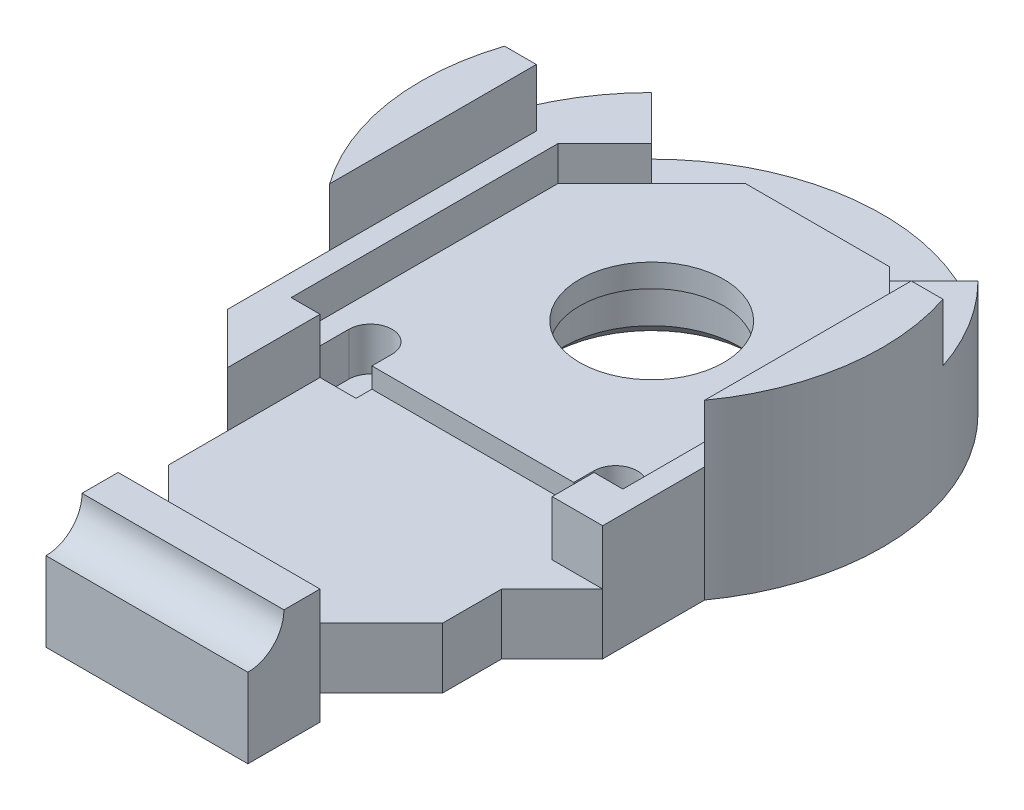
from build123d import *
from build123d.topology import SkipClean

# Parameters (mm, degrees)
BOSS_EXTRUDE1_DEPTH      = 4
SKETCH2_R                = 3.05
CUT_EXTRUDE1_DEPTH       = 2
SKETCH3_R                = 1.5
CUT_EXTRUDE2_DEPTH       = 22.633307653
CUT_EXTRUDE4_START       = -1.2
CUT_EXTRUDE4_DEPTH       = 1.2
CUT_EXTRUDE6_DEPTH       = 1.5
CUT_EXTRUDE7_DEPTH       = 0.7
BOSS_EXTRUDE3_DEPTH      = 2
CUT_EXTRUDE12_START      = -2
CUT_EXTRUDE12_DEPTH      = 2
SKETCH6_R                = 2.5
CUT_EXTRUDE13_DEPTH      = 22.777052142
SKETCH17_W               = 0.35
SKETCH17_H               = 1.45
CUT_EXTRUDE14_DEPTH      = 1.9
BOSS_EXTRUDE5_DEPTH      = 1.9
CUT_EXTRUDE15_DEPTH      = 22.9089023
CUT_EXTRUDE15_DEPTH_BACK = 22.9089023
CUT_EXTRUDE16_DEPTH      = 22.890865675
CUT_EXTRUDE16_DEPTH_BACK = 22.890865675
CUT_EXTRUDE17_DEPTH      = 24.837994882
CUT_EXTRUDE17_DEPTH_BACK = 24.837994882
CHAMFER1_SIZE            = 1.75
CUT_EXTRUDE18_DEPTH      = 24.837994882
BOSS_EXTRUDE6_DEPTH      = 1.9
CHAMFER2_SIZE            = 0.5


with BuildPart() as part:
    # Sketch1 → Boss-Extrude1 (new body)
    with BuildSketch(Plane(origin=(0, 0, 0), x_dir=(1, 0, 0), z_dir=(0, 1, 0))):
        with BuildLine():
            Line((6.5, -20), (6.5, -4.663689527))
            ThreePointArc((6.5, -4.663689527), (7.615773106, -2.449489743), (8, 0))
            ThreePointArc((8, 0), (7.615773106, 2.449489743), (6.5, 4.663689527))
            ThreePointArc((6.5, 4.663689527), (0, 8), (-6.5, 4.663689527))
            ThreePointArc((-6.5, 4.663689527), (-7.615773106, 2.449489743), (-8, 0))
            ThreePointArc((-8, 0), (-7.615773106, -2.449489743), (-6.5, -4.663689527))
            Line((-6.5, -4.663689527), (-6.5, -20))
            Line((-6.5, -20), (6.5, -20))
        make_face()
    extrude(amount=BOSS_EXTRUDE1_DEPTH)

    # Sketch2 → Cut-Extrude1 (cut)
    with BuildSketch(Plane.XZ):
        with Locations(Location((0, 0, 0), (0, 0, 270))):
            Circle(SKETCH2_R)
    extrude(amount=-CUT_EXTRUDE1_DEPTH, mode=Mode.SUBTRACT)

    # Sketch3 → Cut-Extrude2 (cut, through all)
    with BuildSketch(Plane.XZ.offset(-2)):
        with Locations(Location((0, 0, 0), (0, 0, 270))):
            Circle(SKETCH3_R)
    extrude(amount=-CUT_EXTRUDE2_DEPTH, mode=Mode.SUBTRACT)

    # Sketch5 → Cut-Extrude4 (cut)
    with BuildSketch(Plane(origin=(0, 4, 0), x_dir=(1, 0, 0), z_dir=(0, 1, 0)).offset(CUT_EXTRUDE4_START)):
        with BuildLine():
            Line((5.75, 2.5), (2.5, 5.75))
            Line((2.5, 5.75), (0.75, 5.75))
            Line((0.75, 5.75), (0.75, 7.964766161))
            ThreePointArc((0.75, 7.964766161), (0, 8), (-0.75, 7.964766161))
            Line((-0.75, 7.964766161), (-0.75, 5.75))
            Line((-0.75, 5.75), (-2.5, 5.75))
            Line((-2.5, 5.75), (-5.75, 2.5))
            Line((-5.75, 2.5), (-5.75, -6.75))
            Line((-5.75, -6.75), (-4.4, -6.75))
            Line((-4.4, -6.75), (-4.4, -8.2))
            Line((-4.4, -8.2), (-5.66, -10))
            Line((-5.66, -10), (-6.5, -10))
            Line((-6.5, -10), (-6.5, -11.2))
            Line((-6.5, -11.2), (-6.5, -15))
            Line((-6.5, -15), (6.5, -15))
            Line((6.5, -15), (6.5, -11.2))
            Line((6.5, -11.2), (6.5, -10))
            Line((6.5, -10), (6.5, -8.2))
            Line((6.5, -8.2), (4.4, -8.2))
            Line((4.4, -8.2), (4.4, -6.75))
            Line((4.4, -6.75), (5.75, -6.75))
            Line((5.75, -6.75), (5.75, 2.5))
        make_face()
    extrude(amount=CUT_EXTRUDE4_DEPTH, mode=Mode.SUBTRACT)

    # Sketch7 → Cut-Extrude6 (cut)
    with BuildSketch(Plane(origin=(0, 2.8, 0), x_dir=(1, 0, 0), z_dir=(0, 1, 0))):
        with BuildLine():
            Line((-4.999999999, -5.5), (-4.999999999, -6.75))
            Line((-4.999999999, -6.75), (-3.499999999, -6.75))
            Line((-3.499999999, -6.75), (-3.499999999, -5.5))
            ThreePointArc((-3.499999999, -5.5), (-4.249999999, -4.75), (-4.999999999, -5.5))
        make_face()
        with BuildLine():
            Line((3.500000001, -5.5), (3.500000001, -6.75))
            Line((3.500000001, -6.75), (5.000000001, -6.75))
            Line((5.000000001, -6.75), (5.000000001, -5.5))
            ThreePointArc((5.000000001, -5.5), (4.250000001, -4.75), (3.500000001, -5.5))
        make_face()
    extrude(amount=-CUT_EXTRUDE6_DEPTH, mode=Mode.SUBTRACT)

    # Sketch9 → Cut-Extrude7 (cut)
    with BuildSketch(Plane(origin=(0, 2.8, 0), x_dir=(1, 0, 0), z_dir=(0, 1, 0))):
        Polygon((-6.5, -15), (6.5, -15), (6.5, -11.2), (6.5, -10), (6.5, -8.2), (4.75, -8.2), (4.75, -6.2), (4.4, -6.2), (-4.4, -6.2), (-4.75, -6.2), (-4.75, -8.7), (-5.66, -10), (-6.5, -10), (-6.5, -11.2), align=None)
    extrude(amount=-CUT_EXTRUDE7_DEPTH, mode=Mode.SUBTRACT)

    # Sketch14 → Boss-Extrude3 (add)
    with SkipClean():  # the faces are left unmerged after this step: merging them gives an invalid solid
        with BuildSketch(Plane(origin=(0, 4, 0), x_dir=(1, 0, 0), z_dir=(0, 1, 0))):
            with BuildLine():
                Line((6.5, -4.663689527), (6.5, 2.5))
                Line((6.5, 2.5), (7.599342077, 2.5))
                ThreePointArc((7.599342077, 2.5), (7.907431546, -1.213476964), (6.5, -4.663689527))
            make_face()
            with BuildLine():
                Line((-6.5, -4.663689527), (-6.5, 2.5))
                Line((-6.5, 2.5), (-7.599342077, 2.5))
                ThreePointArc((-7.599342077, 2.5), (-7.907431546, -1.213476964), (-6.5, -4.663689527))
            make_face()
        extrude(amount=BOSS_EXTRUDE3_DEPTH)

    # Sketch15 → Cut-Extrude12 (cut)
    with SkipClean():  # the faces are left unmerged after this step: merging them gives an invalid solid
        with BuildSketch(Plane(origin=(0, 4, 0), x_dir=(1, 0, 0), z_dir=(0, 1, 0)).offset(CUT_EXTRUDE12_START)):
            with BuildLine():
                Line((2.5, 5.75), (-2.5, 5.75))
                Line((-2.5, 5.75), (-4.125, 4.125))
                Line((-4.125, 4.125), (-5.656854249, 5.656854249))
                ThreePointArc((-5.656854249, 5.656854249), (0, 8), (5.656854249, 5.656854249))
                Line((5.656854249, 5.656854249), (4.125, 4.125))
                Line((4.125, 4.125), (2.5, 5.75))
            make_face()
        extrude(amount=CUT_EXTRUDE12_DEPTH, mode=Mode.SUBTRACT)

    # Sketch6 → Cut-Extrude13 (cut, through all)
    with SkipClean():  # the faces are left unmerged after this step: merging them gives an invalid solid
        with BuildSketch(Plane(origin=(0, 2.8, 0), x_dir=(1, 0, 0), z_dir=(0, 1, 0))):
            with Locations(Location((0, 0, 0), (0, 0, 270))):
                Circle(SKETCH6_R)
        extrude(amount=-CUT_EXTRUDE13_DEPTH, mode=Mode.SUBTRACT)

    # Sketch17 → Cut-Extrude14 (cut)
    with SkipClean():  # the faces are left unmerged after this step: merging them gives an invalid solid
        with BuildSketch(Plane(origin=(0, 4, 0), x_dir=(1, 0, 0), z_dir=(0, 1, 0))):
            Polygon((-4.75, -6.75), (-4.4, -6.75), (-4.4, -8.2), (-4.75, -8.7), align=None)
            with Locations((4.575, -7.475)):
                Rectangle(SKETCH17_W, SKETCH17_H)
        extrude(amount=-CUT_EXTRUDE14_DEPTH, mode=Mode.SUBTRACT)

    # Sketch18 → Boss-Extrude5 (add)
    with SkipClean():  # the faces are left unmerged after this step: merging them gives an invalid solid
        with BuildSketch(Plane(origin=(0, 2.1, 0), x_dir=(1, 0, 0), z_dir=(0, 1, 0))):
            Polygon((-6.5, -10), (-6.5, -15), (-4.75, -15), (-4.75, -8.7), (-5.66, -10), align=None)
        extrude(amount=BOSS_EXTRUDE5_DEPTH)

    # Sketch19 → Cut-Extrude15 (cut, two sides: drawn at the far end of the back side and taken through both)
    with SkipClean():  # the faces are left unmerged after this step: merging them gives an invalid solid
        with BuildSketch(Plane(origin=(0, 4, 0), x_dir=(1, 0, 0), z_dir=(0, 1, 0)).offset(-CUT_EXTRUDE15_DEPTH_BACK)):
            Polygon((-6.5, -20), (-3.5, -20), (-3.5, -15), (-4.75, -15), (-4.75, -8.2), (-6.5, -8.2), align=None)
            Polygon((4.75, -8.2), (6.5, -8.2), (6.5, -20), (3.5, -20), (3.5, -15), (4.75, -15), align=None)
        extrude(amount=CUT_EXTRUDE15_DEPTH + CUT_EXTRUDE15_DEPTH_BACK, mode=Mode.SUBTRACT)

    # Sketch20 → Cut-Extrude16 (cut, two sides: drawn at the far end of the back side and taken through both)
    with SkipClean():  # the faces are left unmerged after this step: merging them gives an invalid solid
        with BuildSketch(Plane(origin=(0, 2.1, 0), x_dir=(1, 0, 0), z_dir=(0, 1, 0)).offset(-CUT_EXTRUDE16_DEPTH_BACK)):
            Polygon((4.75, -15), (1.75, -15), (4.75, -12), align=None)
            Polygon((-4.75, -15), (-1.75, -15), (-4.75, -12), align=None)
        extrude(amount=CUT_EXTRUDE16_DEPTH + CUT_EXTRUDE16_DEPTH_BACK, mode=Mode.SUBTRACT)

    # Sketch21 → Cut-Extrude17 (cut, two sides: drawn at the far end of the back side and taken through both)
    with SkipClean():  # the faces are left unmerged after this step: merging them gives an invalid solid
        with BuildSketch(Plane(origin=(3.5, 0, 0), x_dir=(0, 0, -1), z_dir=(1, 0, 0)).offset(-CUT_EXTRUDE17_DEPTH_BACK)):
            with BuildLine():
                Line((-18.75, 4), (-16.25, 4))
                ThreePointArc((-16.25, 4), (-17.5, 2.75), (-18.75, 4))
            make_face()
        extrude(amount=CUT_EXTRUDE17_DEPTH + CUT_EXTRUDE17_DEPTH_BACK, mode=Mode.SUBTRACT)

    # Chamfer1
    # the kernel refuses this chamfer: 1.75 mm, written as the material it adds along each edge
    with BuildSketch(Plane(origin=(4.75, 0, 8.2), x_dir=(0.9996219169112968, 0, -0.027495876610586112), z_dir=(0, 1, 0))) as chamfer1_piece_1:
        Polygon((CHAMFER1_SIZE * 0.999621916911, -CHAMFER1_SIZE * 0.0274958766106), (-CHAMFER1_SIZE * 0.0274958766106, -CHAMFER1_SIZE * 0.999621916911), (0, 0), align=None)
    extrude(amount=2.1)
    with BuildSketch(Plane(origin=(-4.75, 2.1, 8.2), x_dir=(0.02749587661058662, 0, 0.9996219169112968), z_dir=(0, -1, 0))) as chamfer1_piece_2:
        Polygon((CHAMFER1_SIZE * 0.999621916911, CHAMFER1_SIZE * 0.0274958766106), (-CHAMFER1_SIZE * 0.0274958766106, CHAMFER1_SIZE * 0.999621916911), (0, 0), align=None)
    extrude(amount=2.1)

    # Sketch22 → Cut-Extrude18 (cut, through all)
    with BuildSketch(Plane(origin=(3.5, 0, 0), x_dir=(0, 0, -1), z_dir=(1, 0, 0))):
        with BuildLine():
            Line((-20, 0), (-17.5, 0))
            Line((-17.5, 0), (-17.5, 2.75))
            ThreePointArc((-17.5, 2.75), (-18.383883476, 3.116116524), (-18.75, 4))
            Line((-18.75, 4), (-20, 4))
            Line((-20, 4), (-20, 2.75))
            Line((-20, 2.75), (-20, 0))
        make_face()
    extrude(amount=-CUT_EXTRUDE18_DEPTH, mode=Mode.SUBTRACT)

    # Sketch24 → Boss-Extrude6 (add)
    with BuildSketch(Plane(origin=(0, 2.1, 0), x_dir=(1, 0, 0), z_dir=(0, 1, 0))):
        Polygon((-6.5, -8.2), (-4.75, -8.2), (-4.75, -9.95), align=None)
    extrude(amount=BOSS_EXTRUDE6_DEPTH)

    # Chamfer2
    chamfer2_edges = [part.edges().sort_by_distance(p)[0] for p in [
        (0, 0, 3.05),
    ]]
    chamfer(chamfer2_edges, length=CHAMFER2_SIZE)


solid = part.part
